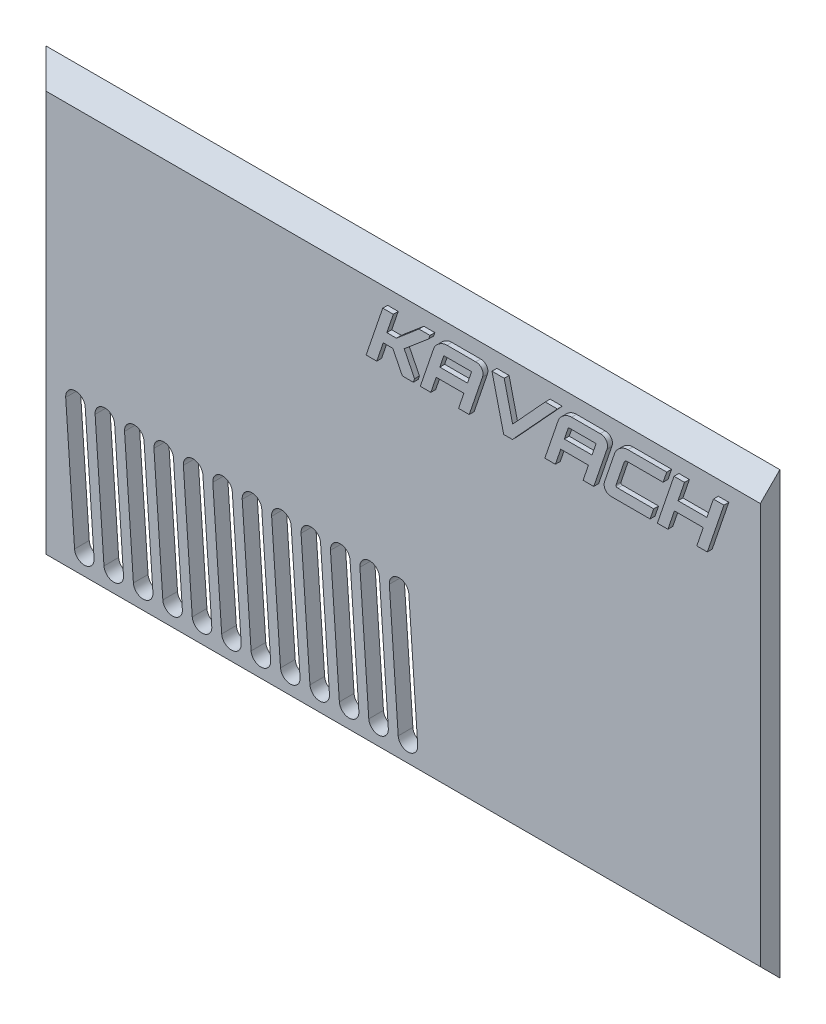
from build123d import *

# Parameters (mm, degrees)
SKETCH1_W           = 75
SKETCH1_H           = 45
BOSS_EXTRUDE1_DEPTH = 2
CHAMFER1_SIZE       = 2
SKETCH4_W           = 2.25
SKETCH4_H           = 3.25
SKETCH4_W_2         = 3.25
SKETCH4_H_2         = 2.25
CUT_EXTRUDE1_DEPTH  = 1.5
CUT_EXTRUDE2_REACH  = 46.637
BOSS_EXTRUDE2_DEPTH = 0.5


with BuildPart() as part:
    # Sketch1 → Boss-Extrude1 (new body)
    with BuildSketch(Plane.XY):
        with Locations((-1, 0)):
            Rectangle(SKETCH1_W, SKETCH1_H)
    extrude(amount=BOSS_EXTRUDE1_DEPTH)

    # Chamfer1
    chamfer1_edges = [part.edges().sort_by_distance(p)[0] for p in [
        (-1, -22.5, 2),
        (-38.5, 0, 2),
        (-1, 22.5, 2),
    ]]
    chamfer(chamfer1_edges, length=CHAMFER1_SIZE - 0.0001)  # a hair under: the kernel refuses the full size

    # Sketch4 → Cut-Extrude1 (cut)
    with BuildSketch(Plane(origin=(0, 0, 0), x_dir=(-1, 0, 0), z_dir=(0, 0, -1))):
        with Locations((-23.375, 18.625)):
            Rectangle(SKETCH4_W, SKETCH4_H)
        with Locations((-23.375, -18.875)):
            Rectangle(SKETCH4_W, SKETCH4_H)
        with Locations((34.625, 0)):
            Rectangle(SKETCH4_W_2, SKETCH4_H_2)
    extrude(amount=-CUT_EXTRUDE1_DEPTH, mode=Mode.SUBTRACT)

    # Shell1: read off the stored shape, not the designer's step
    # Shell1: loft between two sections, ruled curve by curve
    shell1_from = [
        Edge.make_line((26, 20.378679656, 0), (35, 20.378679656, 0)),
        Edge.make_line((-36.378679656, 20.378679656, 0), (20.75, 20.378679656, 0)),
        Edge.make_line((35, -20.378679656, 0), (26, -20.378679656, 0)),
        Edge.make_line((20.75, -20.378679656, 0), (-36.378679656, -20.378679656, 0)),
        Edge.make_line((-36.378679656, -20.378679656, 0), (-36.378679656, -2.625, 0)),
        Edge.make_line((-36.378679656, 2.625, 0), (-36.378679656, 20.378679656, 0)),
        Edge.make_line((35, 20.378679656, 0), (35, -20.378679656, 0)),
        Edge.make_line((-36.378679656, -2.625, 0), (-31.5, -2.625, 0)),
        Edge.make_line((-31.5, -2.625, 0), (-31.5, 2.625, 0)),
        Edge.make_line((-31.5, 2.625, 0), (-36.378679656, 2.625, 0)),
        Edge.make_line((20.75, -15.75, 0), (20.75, -20.378679656, 0)),
        Edge.make_line((20.75, 20.378679656, 0), (20.75, 15.5, 0)),
        Edge.make_line((26, -20.378679656, 0), (26, -15.75, 0)),
        Edge.make_line((26, 15.5, 0), (26, 20.378679656, 0)),
        Edge.make_line((26, -15.75, 0), (20.75, -15.75, 0)),
        Edge.make_line((20.75, 15.5, 0), (26, 15.5, 0)),
    ]
    shell1_to = [
        Edge.make_line((26, 19.878679656, 0.5), (35, 19.878679656, 0.5)),
        Edge.make_line((-35.878679656, 19.878679656, 0.5), (20.75, 19.878679656, 0.5)),
        Edge.make_line((35, -19.878679656, 0.5), (26, -19.878679656, 0.5)),
        Edge.make_line((20.75, -19.878679656, 0.5), (-35.878679656, -19.878679656, 0.5)),
        Edge.make_line((-35.878679656, -19.878679656, 0.5), (-35.878679656, -2.625, 0.5)),
        Edge.make_line((-35.878679656, 2.625, 0.5), (-35.878679656, 19.878679656, 0.5)),
        Edge.make_line((35, 19.878679656, 0.5), (35, -19.878679656, 0.5)),
        Edge.make_line((-35.878679656, -2.625, 0.5), (-31.5, -2.625, 0.5)),
        Edge.make_line((-31.5, -2.625, 0.5), (-31.5, 2.625, 0.5)),
        Edge.make_line((-31.5, 2.625, 0.5), (-35.878679656, 2.625, 0.5)),
        Edge.make_line((20.75, -15.75, 0.5), (20.75, -19.878679656, 0.5)),
        Edge.make_line((20.75, 19.878679656, 0.5), (20.75, 15.5, 0.5)),
        Edge.make_line((26, -19.878679656, 0.5), (26, -15.75, 0.5)),
        Edge.make_line((26, 15.5, 0.5), (26, 19.878679656, 0.5)),
        Edge.make_line((26, -15.75, 0.5), (20.75, -15.75, 0.5)),
        Edge.make_line((20.75, 15.5, 0.5), (26, 15.5, 0.5)),
    ]
    shell1 = Solid(Shell([*[Face.make_surface_from_curves(shell1_from[k], shell1_to[k]) for k in range(16)], Face(Wire(shell1_from)), Face(Wire(shell1_to))]))
    add(shell1, mode=Mode.SUBTRACT)

    # Sketch5 → Cut-Extrude2 (cut, up to next)
    with BuildSketch(Plane(origin=(0, 0, 0), x_dir=(-1, 0, 0), z_dir=(0, 0, -1)), mode=Mode.PRIVATE) as cut_extrude2_sk1:
        with BuildLine():
            Line((34.5, -5.60142382), (33.593165841, -18.569756474))
            ThreePointArc((33.593165841, -18.569756474), (32.525845317, -19.49756405), (31.598037741, -18.430243526))
            Line((31.598037741, -18.430243526), (32.504871899, -5.461910873))
            ThreePointArc((32.504871899, -5.461910873), (33.572192423, -4.534103296), (34.5, -5.60142382))
        make_face()
    cut_extrude2_tool1 = extrude(cut_extrude2_sk1.sketch, amount=-CUT_EXTRUDE2_REACH, mode=Mode.PRIVATE) & part.part
    # Sketch5 → Cut-Extrude2 (cut, up to next)
    with BuildSketch(Plane(origin=(0, 0, 0), x_dir=(-1, 0, 0), z_dir=(0, 0, -1)), mode=Mode.PRIVATE) as cut_extrude2_sk2:
        with BuildLine():
            Line((31.492674306, -5.60142382), (30.585840147, -18.569756474))
            ThreePointArc((30.585840147, -18.569756474), (29.518519623, -19.49756405), (28.590712047, -18.430243526))
            Line((28.590712047, -18.430243526), (29.497546205, -5.461910873))
            ThreePointArc((29.497546205, -5.461910873), (30.564866729, -4.534103296), (31.492674306, -5.60142382))
        make_face()
    cut_extrude2_tool2 = extrude(cut_extrude2_sk2.sketch, amount=-CUT_EXTRUDE2_REACH, mode=Mode.PRIVATE) & part.part
    # Sketch5 → Cut-Extrude2 (cut, up to next)
    with BuildSketch(Plane(origin=(0, 0, 0), x_dir=(-1, 0, 0), z_dir=(0, 0, -1)), mode=Mode.PRIVATE) as cut_extrude2_sk3:
        with BuildLine():
            Line((28.485348612, -5.60142382), (27.578514453, -18.569756474))
            ThreePointArc((27.578514453, -18.569756474), (26.511193929, -19.49756405), (25.583386352, -18.430243526))
            Line((25.583386352, -18.430243526), (26.490220511, -5.461910873))
            ThreePointArc((26.490220511, -5.461910873), (27.557541035, -4.534103296), (28.485348612, -5.60142382))
        make_face()
    cut_extrude2_tool3 = extrude(cut_extrude2_sk3.sketch, amount=-CUT_EXTRUDE2_REACH, mode=Mode.PRIVATE) & part.part
    # Sketch5 → Cut-Extrude2 (cut, up to next)
    with BuildSketch(Plane(origin=(0, 0, 0), x_dir=(-1, 0, 0), z_dir=(0, 0, -1)), mode=Mode.PRIVATE) as cut_extrude2_sk4:
        with BuildLine():
            Line((25.478022917, -5.60142382), (24.571188759, -18.569756474))
            ThreePointArc((24.571188759, -18.569756474), (23.503868235, -19.49756405), (22.576060658, -18.430243526))
            Line((22.576060658, -18.430243526), (23.482894817, -5.461910873))
            ThreePointArc((23.482894817, -5.461910873), (24.550215341, -4.534103296), (25.478022917, -5.60142382))
        make_face()
    cut_extrude2_tool4 = extrude(cut_extrude2_sk4.sketch, amount=-CUT_EXTRUDE2_REACH, mode=Mode.PRIVATE) & part.part
    # Sketch5 → Cut-Extrude2 (cut, up to next)
    with BuildSketch(Plane(origin=(0, 0, 0), x_dir=(-1, 0, 0), z_dir=(0, 0, -1)), mode=Mode.PRIVATE) as cut_extrude2_sk5:
        with BuildLine():
            Line((22.470697223, -5.60142382), (21.563863064, -18.569756474))
            ThreePointArc((21.563863064, -18.569756474), (20.49654254, -19.49756405), (19.568734964, -18.430243526))
            Line((19.568734964, -18.430243526), (20.475569123, -5.461910873))
            ThreePointArc((20.475569123, -5.461910873), (21.542889647, -4.534103296), (22.470697223, -5.60142382))
        make_face()
    cut_extrude2_tool5 = extrude(cut_extrude2_sk5.sketch, amount=-CUT_EXTRUDE2_REACH, mode=Mode.PRIVATE) & part.part
    # Sketch5 → Cut-Extrude2 (cut, up to next)
    with BuildSketch(Plane(origin=(0, 0, 0), x_dir=(-1, 0, 0), z_dir=(0, 0, -1)), mode=Mode.PRIVATE) as cut_extrude2_sk6:
        with BuildLine():
            Line((19.463371529, -5.60142382), (18.55653737, -18.569756474))
            ThreePointArc((18.55653737, -18.569756474), (17.489216846, -19.49756405), (16.56140927, -18.430243526))
            Line((16.56140927, -18.430243526), (17.468243428, -5.461910873))
            ThreePointArc((17.468243428, -5.461910873), (18.535563952, -4.534103296), (19.463371529, -5.60142382))
        make_face()
    cut_extrude2_tool6 = extrude(cut_extrude2_sk6.sketch, amount=-CUT_EXTRUDE2_REACH, mode=Mode.PRIVATE) & part.part
    # Sketch5 → Cut-Extrude2 (cut, up to next)
    with BuildSketch(Plane(origin=(0, 0, 0), x_dir=(-1, 0, 0), z_dir=(0, 0, -1)), mode=Mode.PRIVATE) as cut_extrude2_sk7:
        with BuildLine():
            Line((16.456045835, -5.60142382), (15.549211676, -18.569756474))
            ThreePointArc((15.549211676, -18.569756474), (14.481891152, -19.49756405), (13.554083575, -18.430243526))
            Line((13.554083575, -18.430243526), (14.460917734, -5.461910873))
            ThreePointArc((14.460917734, -5.461910873), (15.528238258, -4.534103296), (16.456045835, -5.60142382))
        make_face()
    cut_extrude2_tool7 = extrude(cut_extrude2_sk7.sketch, amount=-CUT_EXTRUDE2_REACH, mode=Mode.PRIVATE) & part.part
    # Sketch5 → Cut-Extrude2 (cut, up to next)
    with BuildSketch(Plane(origin=(0, 0, 0), x_dir=(-1, 0, 0), z_dir=(0, 0, -1)), mode=Mode.PRIVATE) as cut_extrude2_sk8:
        with BuildLine():
            Line((13.44872014, -5.60142382), (12.541885982, -18.569756474))
            ThreePointArc((12.541885982, -18.569756474), (11.474565458, -19.49756405), (10.546757881, -18.430243526))
            Line((10.546757881, -18.430243526), (11.45359204, -5.461910873))
            ThreePointArc((11.45359204, -5.461910873), (12.520912564, -4.534103296), (13.44872014, -5.60142382))
        make_face()
    cut_extrude2_tool8 = extrude(cut_extrude2_sk8.sketch, amount=-CUT_EXTRUDE2_REACH, mode=Mode.PRIVATE) & part.part
    # Sketch5 → Cut-Extrude2 (cut, up to next)
    with BuildSketch(Plane(origin=(0, 0, 0), x_dir=(-1, 0, 0), z_dir=(0, 0, -1)), mode=Mode.PRIVATE) as cut_extrude2_sk9:
        with BuildLine():
            Line((10.441394446, -5.60142382), (9.534560287, -18.569756474))
            ThreePointArc((9.534560287, -18.569756474), (8.467239763, -19.49756405), (7.539432187, -18.430243526))
            Line((7.539432187, -18.430243526), (8.446266346, -5.461910873))
            ThreePointArc((8.446266346, -5.461910873), (9.51358687, -4.534103296), (10.441394446, -5.60142382))
        make_face()
    cut_extrude2_tool9 = extrude(cut_extrude2_sk9.sketch, amount=-CUT_EXTRUDE2_REACH, mode=Mode.PRIVATE) & part.part
    # Sketch5 → Cut-Extrude2 (cut, up to next)
    with BuildSketch(Plane(origin=(0, 0, 0), x_dir=(-1, 0, 0), z_dir=(0, 0, -1)), mode=Mode.PRIVATE) as cut_extrude2_sk10:
        with BuildLine():
            Line((7.434068752, -5.60142382), (6.527234593, -18.569756474))
            ThreePointArc((6.527234593, -18.569756474), (5.459914069, -19.49756405), (4.532106493, -18.430243526))
            Line((4.532106493, -18.430243526), (5.438940651, -5.461910873))
            ThreePointArc((5.438940651, -5.461910873), (6.506261175, -4.534103296), (7.434068752, -5.60142382))
        make_face()
    cut_extrude2_tool10 = extrude(cut_extrude2_sk10.sketch, amount=-CUT_EXTRUDE2_REACH, mode=Mode.PRIVATE) & part.part
    # Sketch5 → Cut-Extrude2 (cut, up to next)
    with BuildSketch(Plane(origin=(0, 0, 0), x_dir=(-1, 0, 0), z_dir=(0, 0, -1)), mode=Mode.PRIVATE) as cut_extrude2_sk11:
        with BuildLine():
            Line((4.426743058, -5.60142382), (3.519908899, -18.569756474))
            ThreePointArc((3.519908899, -18.569756474), (2.452588375, -19.49756405), (1.524780798, -18.430243526))
            Line((1.524780798, -18.430243526), (2.431614957, -5.461910873))
            ThreePointArc((2.431614957, -5.461910873), (3.498935481, -4.534103296), (4.426743058, -5.60142382))
        make_face()
    cut_extrude2_tool11 = extrude(cut_extrude2_sk11.sketch, amount=-CUT_EXTRUDE2_REACH, mode=Mode.PRIVATE) & part.part
    # Sketch5 → Cut-Extrude2 (cut, up to next)
    with BuildSketch(Plane(origin=(0, 0, 0), x_dir=(-1, 0, 0), z_dir=(0, 0, -1)), mode=Mode.PRIVATE) as cut_extrude2_sk12:
        with BuildLine():
            Line((1.419417363, -5.60142382), (0.512583205, -18.569756474))
            ThreePointArc((0.512583205, -18.569756474), (-0.554737319, -19.49756405), (-1.482544896, -18.430243526))
            Line((-1.482544896, -18.430243526), (-0.575710737, -5.461910873))
            ThreePointArc((-0.575710737, -5.461910873), (0.491609787, -4.534103296), (1.419417363, -5.60142382))
        make_face()
    cut_extrude2_tool12 = extrude(cut_extrude2_sk12.sketch, amount=-CUT_EXTRUDE2_REACH, mode=Mode.PRIVATE) & part.part
    add(cut_extrude2_tool1.solids().sort_by_distance((-33.049019, -12.015834, 0))[0], mode=Mode.SUBTRACT)
    add(cut_extrude2_tool2.solids().sort_by_distance((-30.041693, -12.015834, 0))[0], mode=Mode.SUBTRACT)
    add(cut_extrude2_tool3.solids().sort_by_distance((-27.034367, -12.015834, 0))[0], mode=Mode.SUBTRACT)
    add(cut_extrude2_tool4.solids().sort_by_distance((-24.027042, -12.015834, 0))[0], mode=Mode.SUBTRACT)
    add(cut_extrude2_tool5.solids().sort_by_distance((-21.019716, -12.015834, 0))[0], mode=Mode.SUBTRACT)
    add(cut_extrude2_tool6.solids().sort_by_distance((-18.01239, -12.015834, 0))[0], mode=Mode.SUBTRACT)
    add(cut_extrude2_tool7.solids().sort_by_distance((-15.005065, -12.015834, 0))[0], mode=Mode.SUBTRACT)
    add(cut_extrude2_tool8.solids().sort_by_distance((-11.997739, -12.015834, 0))[0], mode=Mode.SUBTRACT)
    add(cut_extrude2_tool9.solids().sort_by_distance((-8.990413, -12.015834, 0))[0], mode=Mode.SUBTRACT)
    add(cut_extrude2_tool10.solids().sort_by_distance((-5.983088, -12.015834, 0))[0], mode=Mode.SUBTRACT)
    add(cut_extrude2_tool11.solids().sort_by_distance((-2.975762, -12.015834, 0))[0], mode=Mode.SUBTRACT)
    add(cut_extrude2_tool12.solids().sort_by_distance((0.031564, -12.015834, 0))[0], mode=Mode.SUBTRACT)

    # Sketch6 → Boss-Extrude2 (add)
    # profile 1 of 6: a face of its own
    with BuildSketch(Plane.XY.offset(2)):
        Polygon((-3.290597228, 14), (-1.591782681, 19), (-0.508800965, 19), (-1.173860238, 17.040988547), (-0.194354512, 17.040988547), (2.109242033, 19), (3.234417841, 19), (3.106830942, 18.62427165), (0.600300903, 16.499497689), (1.663190194, 14.374723729), (1.535603294, 14), (0.410427486, 14), (-0.563050513, 15.958006831), (-1.54255624, 15.958006831), (-2.207615512, 14), align=None)
    # profile 2 of 6: a face of its own
    with BuildSketch(Plane.XY.offset(2)):
        with BuildLine():
            Line((2.245870524, 14), (3.596081494, 17.972272453))
            add(Edge.make_bspline(
                [(3.596081494, 17.972272453), (3.613892238, 18.018890794), (3.649571448, 18.112278563), (3.720507465, 18.245790986), (3.807996759, 18.371477207), (3.907933439, 18.490839537), (4.020332452, 18.600331871), (4.140534361, 18.700613136), (4.270246912, 18.78673075), (4.405170374, 18.862273279), (4.544467142, 18.923708583), (4.68643765, 18.967088981), (4.829032568, 18.994543659), (4.924741245, 18.998185861), (4.972412617, 19)],
                knots=[0, 0, 0, 0, 0.986544949, 1.976287207, 2.981361579, 4.011020909, 5.050921216, 6.081432526, 7.102941136, 8.125952123, 9.137554151, 10.107705811, 11.057470402, 12, 12, 12, 12], degree=3))
            Line((4.972412617, 19), (7.909925175, 19))
            add(Edge.make_bspline(
                [(7.909925175, 19), (7.95527765, 18.998346011), (8.042770804, 18.995155165), (8.167815989, 18.968401437), (8.281324897, 18.92579408), (8.38040498, 18.863190756), (8.466005747, 18.787710085), (8.538277389, 18.700176439), (8.592235574, 18.599070043), (8.631596155, 18.488098013), (8.654079748, 18.368094969), (8.655281848, 18.240588861), (8.637218417, 18.10679059), (8.61011789, 18.018171604), (8.596081494, 17.972272453)],
                knots=[0, 0, 0, 0, 1.103283443, 2.128433928, 3.099112174, 4.040403335, 4.96476502, 5.868981252, 6.788546832, 7.740235435, 8.727048883, 9.746475497, 10.832813773, 12, 12, 12, 12], degree=3))
            Line((8.596081494, 17.972272453), (7.245870524, 14))
            Line((7.245870524, 14), (6.154851838, 14))
            Line((6.154851838, 14), (6.702370423, 15.611412497))
            Line((6.702370423, 15.611412497), (3.869338476, 15.611412497))
            Line((3.869338476, 15.611412497), (3.321819891, 14))
            Line((3.321819891, 14), (2.245870524, 14))
        make_face()
        Polygon((4.237029857, 16.694394213), (7.070061803, 16.694394213), (7.485975004, 17.916013663), (4.652943057, 17.916013663), align=None, mode=Mode.SUBTRACT)
    # profile 3 of 6: a face of its own
    with BuildSketch(Plane.XY.offset(2)):
        Polygon((10.768072653, 14), (9.571568735, 19), (10.82131758, 19), (11.685291862, 15.368294153), (15.015611331, 19), (16.258327827, 19), (11.664194815, 14), align=None)
    # profile 4 of 6: a face of its own
    with BuildSketch(Plane.XY.offset(2)):
        with BuildLine():
            Line((14.976431102, 14), (16.326642073, 17.972272453))
            add(Edge.make_bspline(
                [(16.326642073, 17.972272453), (16.344452816, 18.018890794), (16.380132027, 18.112278563), (16.451068044, 18.245790986), (16.538557338, 18.371477207), (16.638494018, 18.490839537), (16.750893031, 18.600331871), (16.871094939, 18.700613136), (17.000807491, 18.78673075), (17.135730953, 18.862273279), (17.275027721, 18.923708583), (17.416998229, 18.967088981), (17.559593147, 18.994543659), (17.655301824, 18.998185861), (17.702973196, 19)],
                knots=[0, 0, 0, 0, 0.986544949, 1.976287207, 2.981361579, 4.011020909, 5.050921216, 6.081432526, 7.102941136, 8.125952123, 9.137554151, 10.107705811, 11.057470402, 12, 12, 12, 12], degree=3))
            Line((17.702973196, 19), (20.640485754, 19))
            add(Edge.make_bspline(
                [(20.640485754, 19), (20.685838229, 18.998346011), (20.773331383, 18.995155165), (20.898376568, 18.968401437), (21.011885475, 18.92579408), (21.110965558, 18.863190756), (21.196566325, 18.787710085), (21.268837967, 18.700176439), (21.322796152, 18.599070043), (21.362156733, 18.488098013), (21.384640326, 18.368094969), (21.385842427, 18.240588861), (21.367778995, 18.10679059), (21.340678468, 18.018171604), (21.326642073, 17.972272453)],
                knots=[0, 0, 0, 0, 1.103283443, 2.128433928, 3.099112174, 4.040403335, 4.96476502, 5.868981252, 6.788546832, 7.740235435, 8.727048883, 9.746475497, 10.832813773, 12, 12, 12, 12], degree=3))
            Line((21.326642073, 17.972272453), (19.976431102, 14))
            Line((19.976431102, 14), (18.885412416, 14))
            Line((18.885412416, 14), (19.432931002, 15.611412497))
            Line((19.432931002, 15.611412497), (16.599899055, 15.611412497))
            Line((16.599899055, 15.611412497), (16.052380469, 14))
            Line((16.052380469, 14), (14.976431102, 14))
        make_face()
        Polygon((16.967590435, 16.694394213), (19.800622382, 16.694394213), (20.216535583, 17.916013663), (17.383503636, 17.916013663), align=None, mode=Mode.SUBTRACT)
    # profile 5 of 6: a face of its own
    with BuildSketch(Plane.XY.offset(2)):
        with BuildLine():
            add(Edge.make_bspline(
                [(21.776712396, 14), (21.731367979, 14.001667113), (21.643890373, 14.004883276), (21.518736813, 14.031460515), (21.405505407, 14.074727375), (21.305200932, 14.135072901), (21.220271573, 14.21148106), (21.149919238, 14.299615191), (21.096167521, 14.40016807), (21.057786257, 14.510897824), (21.037897699, 14.631430382), (21.037292141, 14.759135395), (21.056528271, 14.893272833), (21.084236255, 14.981837883), (21.098593047, 15.027727547)],
                knots=[0, 0, 0, 0, 1.103961918, 2.12974283, 3.101018004, 4.045570211, 4.964397985, 5.870420315, 6.779486998, 7.729065417, 8.713649848, 9.741764588, 10.829903392, 12, 12, 12, 12], degree=3))
            Line((21.098593047, 15.027727547), (22.09919582, 17.972272453))
            add(Edge.make_bspline(
                [(22.09919582, 17.972272453), (22.117002216, 18.01889447), (22.152672718, 18.112289603), (22.223674553, 18.245746374), (22.311031019, 18.371827065), (22.412119805, 18.490500495), (22.524392249, 18.600381896), (22.644668943, 18.700599918), (22.774361675, 18.786734266), (22.909290436, 18.862272419), (23.048585786, 18.923708539), (23.190556741, 18.967089916), (23.332821913, 18.994476651), (23.428192022, 18.998167918), (23.475526943, 19)],
                knots=[0, 0, 0, 0, 0.986737099, 1.976672129, 2.981942259, 4.016077064, 5.056179913, 6.086891935, 7.108599505, 8.131809744, 9.143608801, 10.113949418, 11.063898995, 12, 12, 12, 12], degree=3))
            Line((23.475526943, 19), (27.433734699, 19))
            Line((27.433734699, 19), (27.066043318, 17.916013663))
            Line((27.066043318, 17.916013663), (23.386115651, 17.916013663))
            add(Edge.make_bspline(
                [(23.386115651, 17.916013663), (23.368296551, 17.91563709), (23.33329248, 17.914897347), (23.283338802, 17.903191631), (23.236961691, 17.886323552), (23.19542268, 17.861559816), (23.156885394, 17.83057896), (23.126690354, 17.788577014), (23.097256889, 17.741766262), (23.084387403, 17.70570647), (23.077696925, 17.686960016)],
                knots=[0, 0, 0, 0, 1.028990258, 2.021361749, 2.953805077, 3.874692514, 4.810353948, 5.791300981, 6.851760579, 8, 8, 8, 8], degree=3))
            Line((23.077696925, 17.686960016), (22.270986055, 15.312035363))
            add(Edge.make_bspline(
                [(22.270986055, 15.312035363), (22.265775384, 15.294752734), (22.256183729, 15.262939365), (22.250204818, 15.216650163), (22.254714019, 15.175891523), (22.270203894, 15.141456971), (22.295371849, 15.113906497), (22.330590658, 15.095885317), (22.373814134, 15.084995607), (22.405528761, 15.083688667), (22.422683865, 15.082981716)],
                knots=[0, 0, 0, 0, 1.258790946, 2.317146376, 3.23623916, 4.083568596, 4.910666226, 5.789336011, 6.804205717, 8, 8, 8, 8], degree=3))
            Line((22.422683865, 15.082981716), (26.102611532, 15.082981716))
            Line((26.102611532, 15.082981716), (25.734920152, 14))
            Line((25.734920152, 14), (21.776712396, 14))
        make_face()
    # profile 6 of 6: a face of its own
    with BuildSketch(Plane.XY.offset(2)):
        Polygon((26.478339883, 14), (28.17715443, 19), (29.253103797, 19), (28.588044524, 17.040988547), (31.539621779, 17.040988547), (32.204681052, 19), (33.280630419, 19), (31.581815872, 14), (30.505866505, 14), (31.170925778, 15.958006831), (28.219348522, 15.958006831), (27.55428925, 14), align=None)
    extrude(amount=BOSS_EXTRUDE2_DEPTH)


solid = part.part
